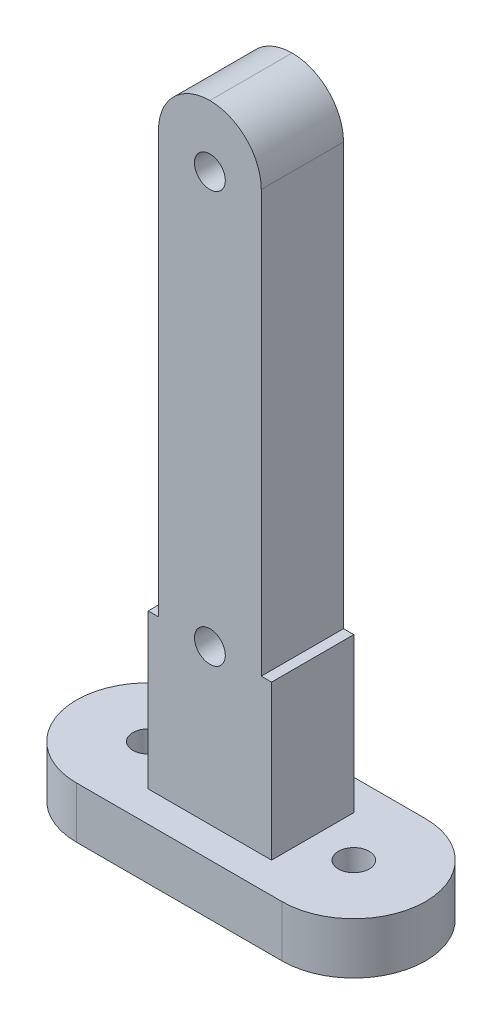
from build123d import *

# Parameters (mm, degrees)
SKETCH1_R           = 1.5
BOSS_EXTRUDE1_DEPTH = 5
SKETCH3_W           = 12
SKETCH3_H           = 8
BOSS_EXTRUDE3_DEPTH = 15
BOSS_EXTRUDE4_START = -8
SKETCH4_W           = 10
SKETCH4_H           = 50.375497142
SKETCH4_R           = 1.5
BOSS_EXTRUDE4_DEPTH = 8
FILLET1_R           = 5
CUT_EXTRUDE1_START  = -8
SKETCH5_R           = 1.5
CUT_EXTRUDE1_DEPTH  = 8


with BuildPart() as part:
    # Sketch1 → Boss-Extrude1 (new body)
    with BuildSketch(Plane(origin=(0, 0, 0), x_dir=(1, 0, 0), z_dir=(0, 1, 0))):
        with BuildLine():
            Line((-10, 6.982882733), (10, 6.982882733))
            ThreePointArc((10, 6.982882733), (16.982882733, 0), (10, -6.982882733))
            Line((10, -6.982882733), (-10, -6.982882733))
            ThreePointArc((-10, -6.982882733), (-16.982882733, 0), (-10, 6.982882733))
        make_face()
        with Locations(Location((-10, 0, 0), (0, 0, 270))):
            Circle(SKETCH1_R, mode=Mode.SUBTRACT)
        with Locations(Location((10, 0, 0), (0, 0, 270))):
            Circle(SKETCH1_R, mode=Mode.SUBTRACT)
    extrude(amount=BOSS_EXTRUDE1_DEPTH)

    # Sketch3 → Boss-Extrude3 (add)
    with BuildSketch(Plane(origin=(0, 5, 0), x_dir=(1, 0, 0), z_dir=(0, 1, 0))):
        Rectangle(SKETCH3_W, SKETCH3_H)
    extrude(amount=BOSS_EXTRUDE3_DEPTH)

    # Sketch4 → Boss-Extrude4 (add)
    with BuildSketch(Plane.XY.offset(4).offset(BOSS_EXTRUDE4_START)):
        with Locations((0, 40.812251429)):
            Rectangle(SKETCH4_W, SKETCH4_H)
        with Locations((0, 20)):
            Circle(SKETCH4_R, mode=Mode.SUBTRACT)
        with Locations((0, 60)):
            Circle(SKETCH4_R, mode=Mode.SUBTRACT)
    extrude(amount=BOSS_EXTRUDE4_DEPTH)

    # Fillet1
    fillet1_edges = [part.edges().sort_by_distance(p)[0] for p in [
        (-5, 66, 0),
        (5, 66, 0),
    ]]
    fillet(fillet1_edges, radius=FILLET1_R - 0.0001)  # a hair under: the kernel refuses the full size

    # Sketch5 → Cut-Extrude1 (cut)
    with BuildSketch(Plane.XY.offset(4).offset(CUT_EXTRUDE1_START)):
        with Locations((0, 20)):
            Circle(SKETCH5_R)
    extrude(amount=CUT_EXTRUDE1_DEPTH, mode=Mode.SUBTRACT)


solid = part.part
